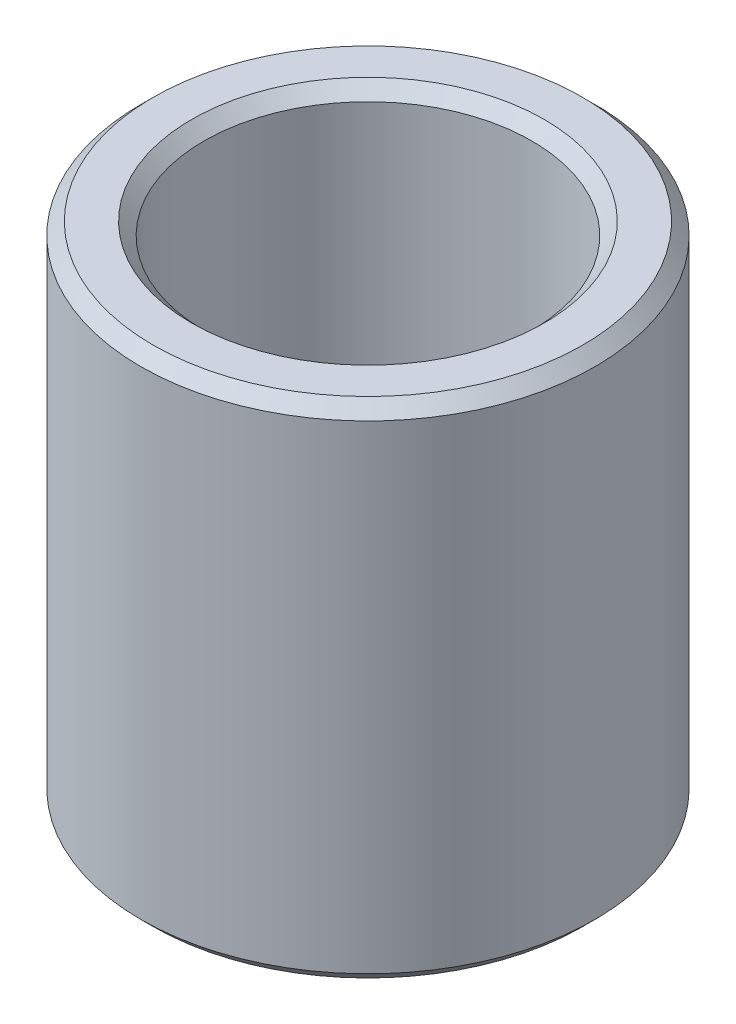
from build123d import *

# Parameters (mm, degrees)
SKETCH1_R           = 50
BOSS_EXTRUDE1_DEPTH = 110.868427263
SKETCH2_R           = 36.091967585
CUT_EXTRUDE1_DEPTH  = 132.498320004
CHAMFER1_SIZE       = 2.731523462


with BuildPart() as part:
    # Sketch1 → Boss-Extrude1 (new body)
    with BuildSketch(Plane(origin=(0, 0, 0), x_dir=(1, 0, 0), z_dir=(0, 1, 0))):
        Circle(SKETCH1_R)
    extrude(amount=BOSS_EXTRUDE1_DEPTH)

    # Sketch2 → Cut-Extrude1 (cut, through all)
    with BuildSketch(Plane(origin=(0, 0, 0), x_dir=(1, 0, 0), z_dir=(0, 1, 0))):
        Circle(SKETCH2_R)
    extrude(amount=CUT_EXTRUDE1_DEPTH, mode=Mode.SUBTRACT)

    # Chamfer1
    chamfer1_edges = [part.edges().sort_by_distance(p)[0] for p in [
        (-36.091967585, 110.868427263, 0),
        (-36.091967585, 0, 0),
        (-50, 0, 0),
        (-50, 110.868427263, 0),
    ]]
    chamfer(chamfer1_edges, length=CHAMFER1_SIZE)


solid = part.part
